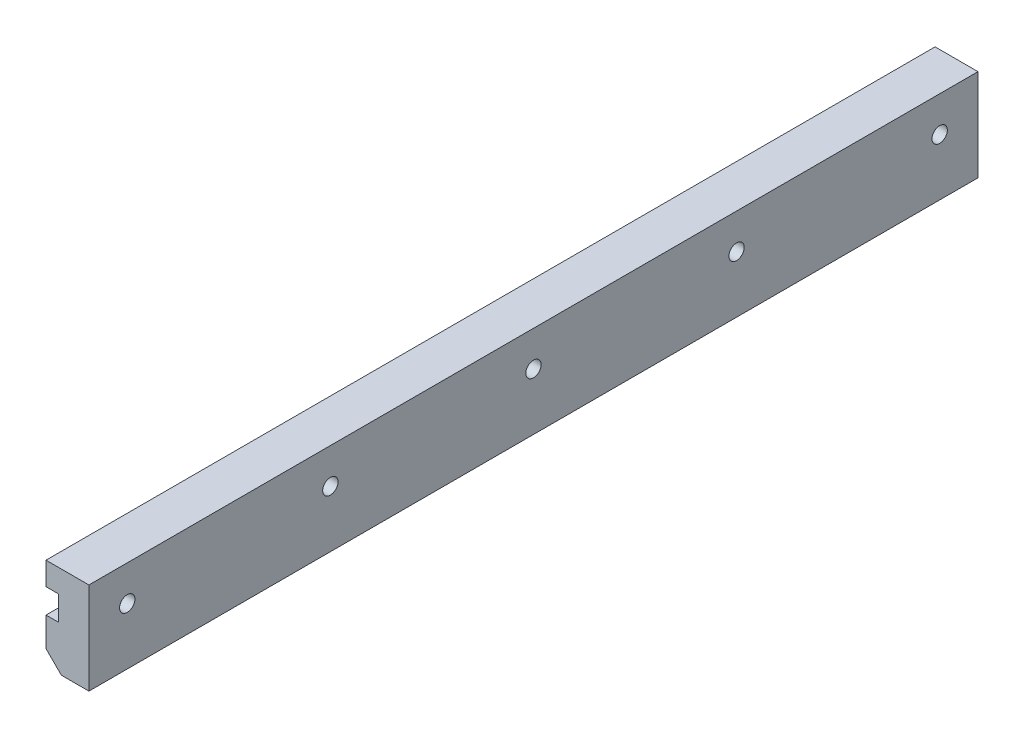
from build123d import *

# Parameters (mm, degrees)
BOSS_EXTRUDE1_DEPTH = 580
SKETCH2_R           = 5
CUT_EXTRUDE1_DEPTH  = 584.767076838


with BuildPart() as part:
    # Sketch1 → Boss-Extrude1 (new body)
    with BuildSketch(Plane.XY):
        Polygon((-18, 0), (0, 0), (0, 60), (-28, 60), (-28, 45), (-20, 45), (-20, 29), (-28, 29), (-28, 10), align=None)
    extrude(amount=-BOSS_EXTRUDE1_DEPTH)

    # Sketch2 → Cut-Extrude1 (cut, through all)
    with BuildSketch(Plane(origin=(0, 0, 0), x_dir=(0, 0, -1), z_dir=(1, 0, 0))):
        with Locations((25, 37)):
            Circle(SKETCH2_R)
        with Locations((157.5, 37)):
            Circle(SKETCH2_R)
        with Locations((290, 37)):
            Circle(SKETCH2_R)
        with Locations((422.5, 37)):
            Circle(SKETCH2_R)
        with Locations((555, 37)):
            Circle(SKETCH2_R)
    extrude(amount=-CUT_EXTRUDE1_DEPTH, mode=Mode.SUBTRACT)


solid = part.part
